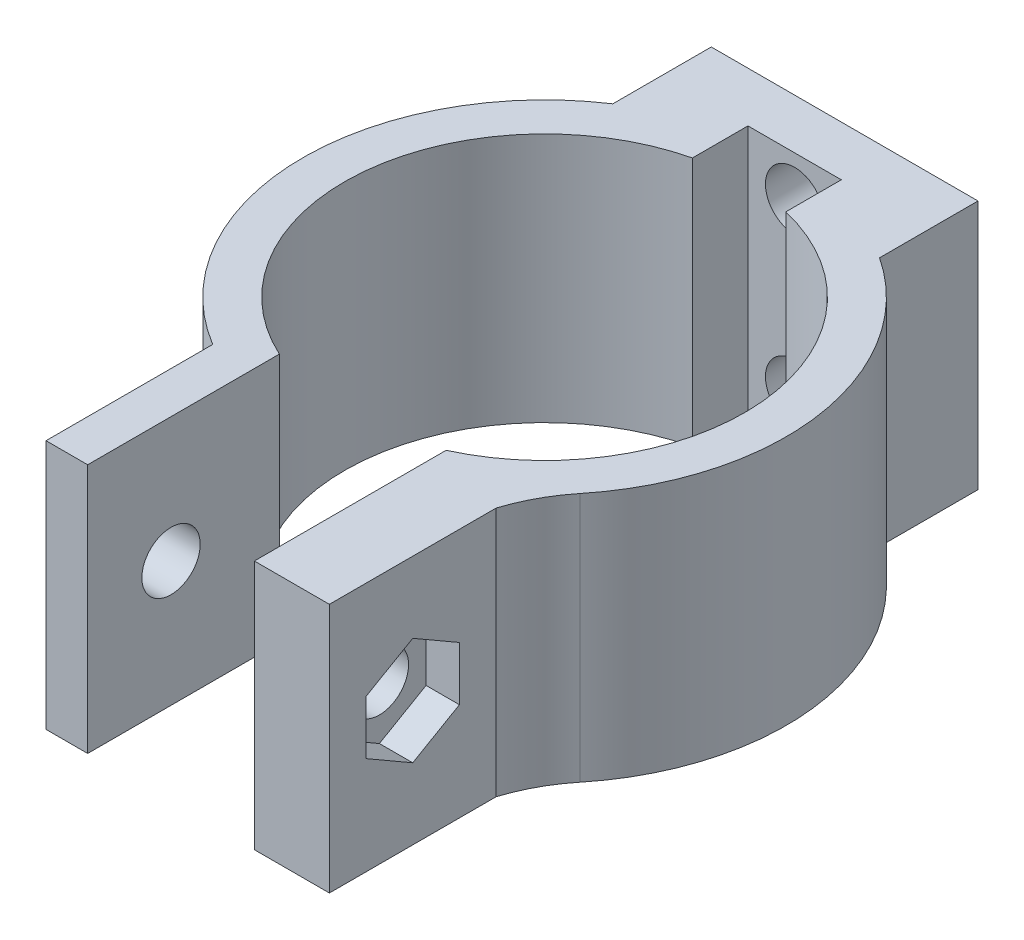
from build123d import *

# Parameters (mm, degrees)
RESSALTO_EXTRUS_O6_DEPTH   = 15
CORTE_EXTRUS_O1_DEPTH      = 46.47737596
CORTE_EXTRUS_O1_DEPTH_BACK = 46.47737596
ESBO_O14_R                 = 1.75
ESBO_O15_R                 = 1.75
CORTE_EXTRUS_O2_DEPTH      = 35.802205001
ESBO_O17_W                 = 10
ESBO_O17_H                 = 15
RESSALTO_EXTRUS_O7_DEPTH   = 2
FILETE1_R                  = 10


with BuildPart() as part:
    # Esboço13 → Ressalto-extrusão6 (new body)
    with BuildSketch(Plane(origin=(0, 0, 0), x_dir=(1, 0, 0), z_dir=(0, 1, 0))):
        with BuildLine():
            Line((-2.8, 15), (0, 15))
            Line((0, 15), (0, 15.348469228))
            Line((0, 15.348469228), (0, 16.348469228))
            Line((0, 16.348469228), (0, 18))
            Line((0, 18), (-8, 18))
            Line((-8, 18), (-8, 12.093386622))
            ThreePointArc((-8, 12.093386622), (-14.496982121, -0.295819827), (-7.5, -12.409673646))
            Line((-7.5, -12.409673646), (-7.5, -22.409673646))
            Line((-7.5, -22.409673646), (-5, -22.409673646))
            Line((-5, -22.409673646), (-5, -10.908712115))
            ThreePointArc((-5, -10.908712115), (-11.943432553, 1.16379502), (-2.8, 11.668761717))
            Line((-2.8, 11.668761717), (-2.8, 15))
        make_face()
        with BuildLine():
            ThreePointArc((2.8, 11.668761717), (11.943432553, 1.16379502), (5, -10.908712115))
            Line((5, -10.908712115), (5, -22.409673646))
            Line((5, -22.409673646), (7.5, -22.409673646))
            Line((7.5, -22.409673646), (7.5, -12.409673646))
            ThreePointArc((7.5, -12.409673646), (14.496982121, -0.295819827), (8, 12.093386622))
            Line((8, 12.093386622), (8, 18))
            Line((8, 18), (0, 18))
            Line((0, 18), (0, 16.348469228))
            Line((0, 16.348469228), (0, 15.348469228))
            Line((0, 15.348469228), (0, 15))
            Line((0, 15), (2.8, 15))
            Line((2.8, 15), (2.8, 11.668761717))
        make_face()
    extrude(amount=RESSALTO_EXTRUS_O6_DEPTH)

    # Esboço14 → Corte-extrusão1 (cut, two sides: drawn at the far end of the back side and taken through both)
    with BuildSketch(Plane(origin=(0, 0, -18), x_dir=(-1, 0, 0), z_dir=(0, 0, -1)).offset(-CORTE_EXTRUS_O1_DEPTH_BACK)):
        with Locations((0, 12.5)):
            Circle(ESBO_O14_R)
        with Locations((0, 2.5)):
            Circle(ESBO_O14_R)
    extrude(amount=CORTE_EXTRUS_O1_DEPTH + CORTE_EXTRUS_O1_DEPTH_BACK, mode=Mode.SUBTRACT)

    # Esboço15 → Corte-extrusão2 (cut, through all)
    with BuildSketch(Plane(origin=(7.5, 0, 0), x_dir=(0, 0, -1), z_dir=(1, 0, 0))):
        with Locations((-17.409673646, 7.5)):
            Circle(ESBO_O15_R)
    extrude(amount=-CORTE_EXTRUS_O2_DEPTH, mode=Mode.SUBTRACT)

    # Esboço17 → Ressalto-extrusão7 (add)
    with BuildSketch(Plane(origin=(7.5, 0, 0), x_dir=(0, 0, -1), z_dir=(1, 0, 0))):
        with Locations((-17.409673646, 7.5)):
            Rectangle(ESBO_O17_W, ESBO_O17_H)
        Polygon((-17.409673646, 10.733161507), (-20.209673646, 9.116580754), (-20.209673646, 5.883419246), (-17.409673646, 4.266838493), (-14.609673646, 5.883419246), (-14.609673646, 9.116580754), align=None, mode=Mode.SUBTRACT)
    extrude(amount=RESSALTO_EXTRUS_O7_DEPTH)

    # Filete1
    # the kernel refuses this fillet: 10 mm, written as the material it adds along each edge
    with BuildSketch(Plane(origin=(7.5, 0, 12.409673646), x_dir=(0.7539844158894258, 0, -0.656892305173292), z_dir=(0, 1, 0))) as filete1_piece_1:
        with BuildLine():
            CenterArc((6.715896851, -9.850615741), FILETE1_R, 99.91590085, 21.469545267)
            Line((1.507968832, -1.31378461), (0, 0))
            ThreePointArc((0, 0), (2.496936009, -0.216607176), (4.993872017, 0))
        make_face()
    extrude(amount=15)


solid = part.part
